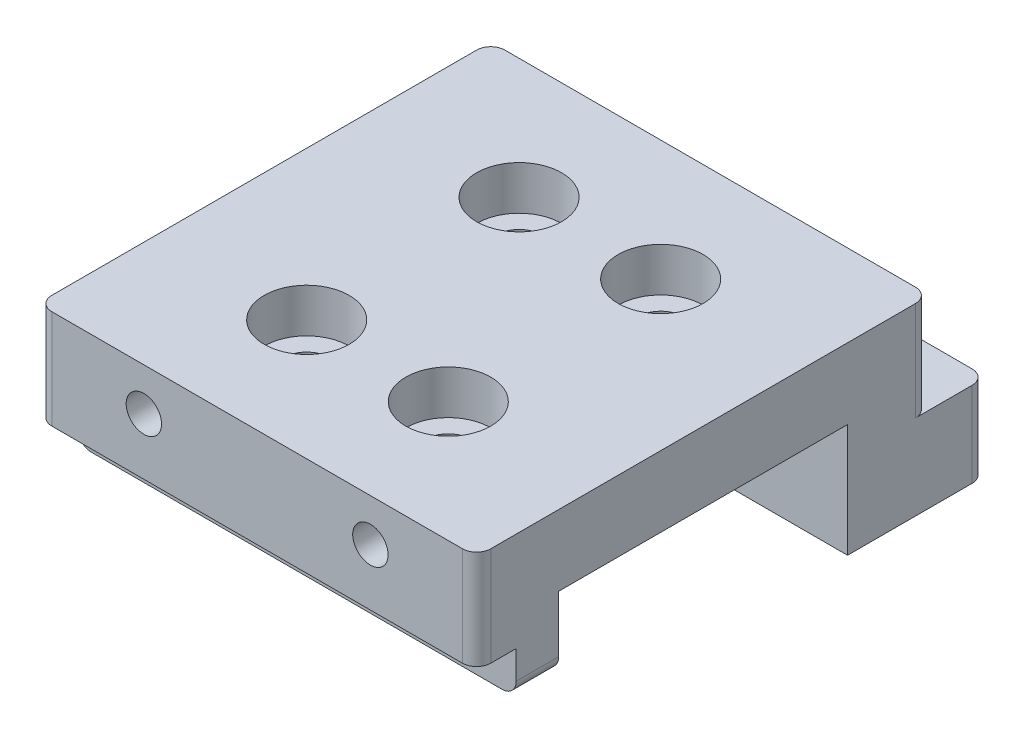
from build123d import *

# Parameters (mm, degrees)
SKETCH_1_W                     = 31
SKETCH_1_H                     = 40
SKETCH_1_R                     = 1.6
EXTRUDE_1_DEPTH                = 5
SKETCH_2_W                     = 31
SKETCH_2_H                     = 9.8
EXTRUDE_3_DEPTH                = 8
SKETCH_13_R                    = 1
CUT_EXTRUDE_7_DEPTH            = 5
EXTRUDE_START                  = 1
SKETCH_14_R                    = 3
SKETCH_14_R_2                  = 1
EXTRUDE_8_DEPTH                = 1
HOLE_WIZARD_M3_3_D             = 2.5
HOLE_WIZARD_M3_3_DEPTH         = 6.5
HOLE_WIZARD_M3_3_TIP           = 0.751075774
SKETCH_18_W                    = 31
SKETCH_18_H                    = 3
EXTRUDE_9_DEPTH                = 10
SKETCH_29_W                    = 31
SKETCH_29_H                    = 6.8
EXTRUDE_11_DEPTH               = 2
SKETCH_20_R                    = 1
CUT_EXTRUDE_9_DEPTH            = 9
HOLE_START                     = -9
HOLE_WIZARD_M3_1_OUTLINE_R     = 1.25
HOLE_WIZARD_M3_1_OUTLINE_R_2   = 1
HOLE_WIZARD_M3_1_DEPTH         = 9
HOLE_WIZARD_M3_1_3_D           = 3.2
HOLE_WIZARD_M3_1_3_CBORE_D     = 6
HOLE_WIZARD_M3_1_3_CBORE_DEPTH = 3.1
HOLE_START_2                   = -40
HOLE_WIZARD_M3_2_OUTLINE_R     = 1.25
HOLE_WIZARD_M3_2_OUTLINE_R_2   = 1
HOLE_WIZARD_M3_2_DEPTH         = 9
SKETCH_30_W                    = 31
SKETCH_30_H                    = 7
CUT_EXTRUDE_10_DEPTH           = 4
FILLET_3_R                     = 1


# Read off the part's stored shape, not the designer's step: M3 螺纹孔1, M3 螺纹孔2
with BuildPart() as part:
    # 草图1 → 凸台-拉伸1 (new body)
    with BuildSketch(Plane(origin=(0, 0, 0), x_dir=(1, 0, 0), z_dir=(0, 1, 0))):
        with Locations((15.5, 20)):
            Rectangle(SKETCH_1_W, SKETCH_1_H)
        with Locations(Location((20.5, 27.5, 0), (0, 0, 270))):
            Circle(SKETCH_1_R, mode=Mode.SUBTRACT)
        with Locations(Location((10.5, 27.5, 0), (0, 0, 270))):
            Circle(SKETCH_1_R, mode=Mode.SUBTRACT)
        with Locations(Location((10.5, 12.5, 0), (0, 0, 90))):
            Circle(SKETCH_1_R, mode=Mode.SUBTRACT)
        with Locations(Location((20.5, 12.5, 0), (0, 0, 90))):
            Circle(SKETCH_1_R, mode=Mode.SUBTRACT)
    extrude(amount=EXTRUDE_1_DEPTH)

    # 草图2 → 凸台-拉伸3 (add)
    with BuildSketch(Plane(origin=(0, 0, 0), x_dir=(1, 0, 0), z_dir=(0, 1, 0))):
        with Locations((15.5, 35.1)):
            Rectangle(SKETCH_2_W, SKETCH_2_H)
    extrude(amount=-EXTRUDE_3_DEPTH)

    # 草图13 → 切除-拉伸7 (cut)
    with BuildSketch(Plane.XZ.offset(8)):
        with Locations(Location((15.5, -35.1, 0), (0, 0, 270))):
            Circle(SKETCH_13_R)
    extrude(amount=-CUT_EXTRUDE_7_DEPTH, mode=Mode.SUBTRACT)

    # 草图14 → 凸台-拉伸8 (add)
    with BuildSketch(Plane.XZ.offset(8).offset(EXTRUDE_START)):
        with Locations(Location((15.5, -35.1, 0), (0, 0, 270))):
            Circle(SKETCH_14_R)
        with Locations(Location((15.5, -35.1, 0), (0, 0, 270))):
            Circle(SKETCH_14_R_2, mode=Mode.SUBTRACT)
    extrude(amount=-EXTRUDE_8_DEPTH)

    # M3 螺纹孔3
    with Locations(Plane(origin=(0, -9, 0), x_dir=(-1, 0, 0), z_dir=(0, -1, 0))):
        with Locations((-15.5, 35.1)):
            Hole(HOLE_WIZARD_M3_3_D / 2, depth=HOLE_WIZARD_M3_3_DEPTH)
            with Locations((0, 0, -(HOLE_WIZARD_M3_3_DEPTH + HOLE_WIZARD_M3_3_TIP / 2))):  # 118° drill point
                Cone(0, HOLE_WIZARD_M3_3_D / 2, HOLE_WIZARD_M3_3_TIP, mode=Mode.SUBTRACT)

    # 草图18 → 凸台-拉伸9 (add)
    with BuildSketch(Plane(origin=(0, 5, 0), x_dir=(1, 0, 0), z_dir=(0, 1, 0))):
        with Locations((15.5, 8.3)):
            Rectangle(SKETCH_18_W, SKETCH_18_H)
    extrude(amount=-EXTRUDE_9_DEPTH)

    # 草图29 → 凸台-拉伸11 (add)
    with BuildSketch(Plane.XZ):
        with Locations((15.5, -3.4)):
            Rectangle(SKETCH_29_W, SKETCH_29_H)
    extrude(amount=EXTRUDE_11_DEPTH)

    # 草图20 → 切除-拉伸9 (cut)
    with BuildSketch(Plane.XY):
        with Locations((7.5, 2)):
            Circle(SKETCH_20_R)
        with Locations(Location((23.5, 2, 0), (0, 0, 180))):
            Circle(SKETCH_20_R)
    cut_extrude_9 = extrude(amount=-CUT_EXTRUDE_9_DEPTH, mode=Mode.SUBTRACT)

    # Hole Wizard M3 _1 outline → Hole Wizard M3 _1 (cut)
    with BuildSketch(Plane.XY.offset(HOLE_START)):
        with Locations((23.5, 2)):
            Circle(HOLE_WIZARD_M3_1_OUTLINE_R)
        with Locations((23.5, 2)):
            Circle(HOLE_WIZARD_M3_1_OUTLINE_R_2, mode=Mode.SUBTRACT)
    extrude(amount=HOLE_WIZARD_M3_1_DEPTH, mode=Mode.SUBTRACT)

    # Hole Wizard M3 _1 2 outline → Hole Wizard M3 _1 2 (revolve, cut)
    with BuildSketch(Plane(origin=(7.5, 2, 0), x_dir=(1, 0, 0), z_dir=(0, -1, 0))):
        Polygon((0, -9), (0, -9.751075774), (1.25, -9), (1.25, 0), (1, 0), (1, -9), align=None)
    revolve(axis=Axis((7.5, 2, 0), (0, 0, 1)), mode=Mode.SUBTRACT)

    # 镜向1: 切除-拉伸9 across plane
    add(cut_extrude_9.mirror(Plane.XY.offset(-20)), mode=Mode.SUBTRACT)

    # Hole Wizard M3 _1 3 (through all)
    with Locations(Plane(origin=(0, 5, 0), x_dir=(1, 0, 0), z_dir=(0, 1, 0))):
        with Locations((10.5, 27.5), (10.5, 12.5), (20.5, 12.5), (20.5, 27.5)):
            CounterBoreHole(HOLE_WIZARD_M3_1_3_D / 2, HOLE_WIZARD_M3_1_3_CBORE_D / 2, HOLE_WIZARD_M3_1_3_CBORE_DEPTH)

    # M3 螺纹孔2 outline → M3 螺纹孔2 (cut)
    with BuildSketch(Plane.XY.offset(HOLE_START_2)):
        with Locations((7.5, 2)):
            Circle(HOLE_WIZARD_M3_2_OUTLINE_R)
        with Locations((7.5, 2)):
            Circle(HOLE_WIZARD_M3_2_OUTLINE_R_2, mode=Mode.SUBTRACT)
    extrude(amount=HOLE_WIZARD_M3_2_DEPTH, mode=Mode.SUBTRACT)

    # Hole Wizard M3 _2 2 outline → Hole Wizard M3 _2 2 (revolve, cut)
    with BuildSketch(Plane(origin=(23.5, 2, 0), x_dir=(1, 0, 0), z_dir=(0, -1, 0))):
        Polygon((1.25, -31), (0, -30.248924226), (0, -31), (1, -31), (1, -40), (1.25, -40), align=None)
    revolve(axis=Axis((23.5, 2, 0), (0, 0, 1)), mode=Mode.SUBTRACT)

    # 草图30 → 切除-拉伸10 (cut)
    with BuildSketch(Plane.XY):
        with Locations((15.5, 1.5)):
            Rectangle(SKETCH_30_W, SKETCH_30_H)
    cut_extrude_10 = extrude(amount=-CUT_EXTRUDE_10_DEPTH, mode=Mode.SUBTRACT)

    # 镜向3: 切除-拉伸10 across plane
    add(cut_extrude_10.mirror(Plane.XY.offset(-20)), mode=Mode.SUBTRACT)

    # 圆角3
    fillet_3_edges = [part.edges().sort_by_distance(p)[0] for p in [
        (31, 1.5, -4),
        (0, 1.5, -4),
        (31, -5, -40),
        (0, -5, -40),
        (0, 1.5, -36),
        (31, 1.5, -36),
        (31, -5, -8.3),
        (0, -5, -8.3),
    ]]
    fillet(fillet_3_edges, radius=FILLET_3_R)


solid = part.part
